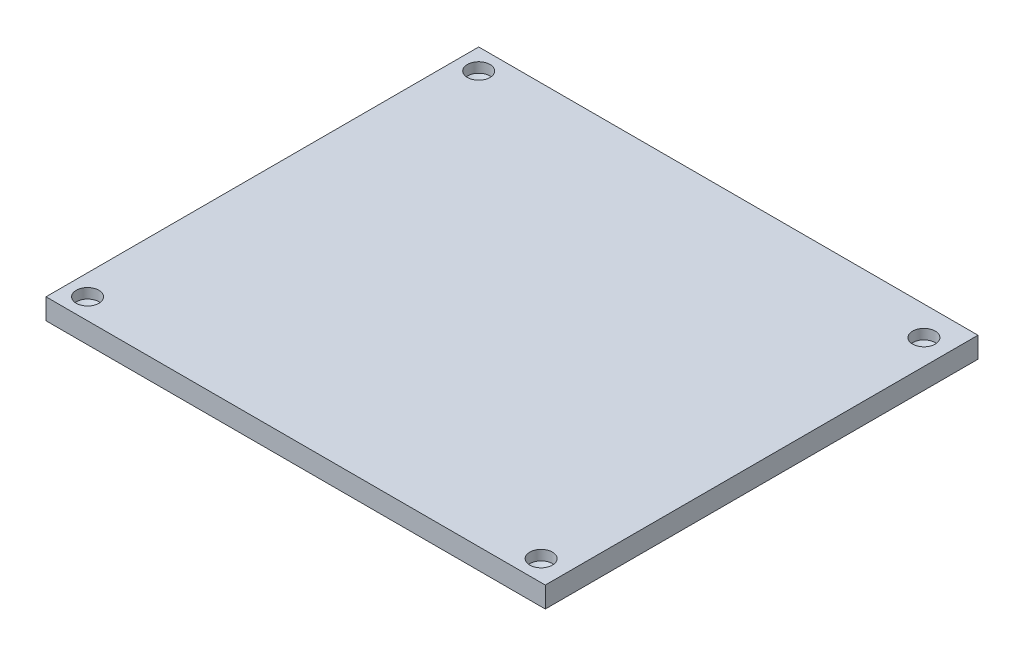
from build123d import *

# Parameters (mm, degrees)
SKETCH1_W                 = 76.2
SKETCH1_H                 = 66.04
BOSS_EXTRUDE1_DEPTH       = 3.175
F_4_CLEARANCE_HOLE1_D     = 3.4544
F_4_CLEARANCE_HOLE1_DEPTH = 10.16
F_4_CLEARANCE_HOLE1_TIP   = 1.037806461


with BuildPart() as part:
    # Sketch1 → Boss-Extrude1 (new body)
    with BuildSketch(Plane(origin=(0, 0, 0), x_dir=(1, 0, 0), z_dir=(0, 1, 0))):
        Rectangle(SKETCH1_W, SKETCH1_H)
    extrude(amount=BOSS_EXTRUDE1_DEPTH)

    # #4 Clearance Hole1
    with Locations(Plane(origin=(0, 11.811, 0), x_dir=(1, 0, 0), z_dir=(0, 1, 0))):
        with Locations((-34.925, 29.845), (34.29, 28.575), (34.29, -29.845), (-34.925, -29.845)):
            Hole(F_4_CLEARANCE_HOLE1_D / 2, depth=F_4_CLEARANCE_HOLE1_DEPTH)
            with Locations((0, 0, -(F_4_CLEARANCE_HOLE1_DEPTH + F_4_CLEARANCE_HOLE1_TIP / 2))):  # 118° drill point
                Cone(0, F_4_CLEARANCE_HOLE1_D / 2, F_4_CLEARANCE_HOLE1_TIP, mode=Mode.SUBTRACT)


solid = part.part
